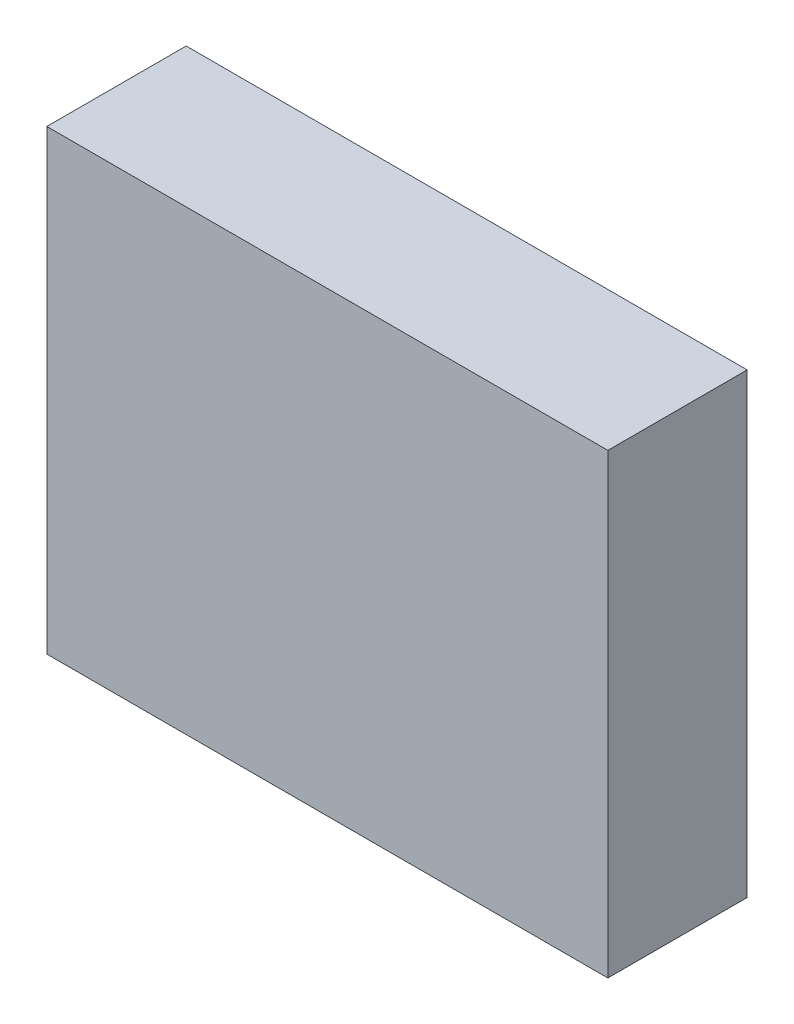
from build123d import *

# Parameters (mm, degrees)
SKETCH1_W           = 62
SKETCH1_H           = 50.5
BOSS_EXTRUDE1_DEPTH = 15.4


with BuildPart() as part:
    # Sketch1 → Boss-Extrude1 (new body)
    with BuildSketch(Plane.XY):
        Rectangle(SKETCH1_W, SKETCH1_H)
    extrude(amount=BOSS_EXTRUDE1_DEPTH)


solid = part.part
